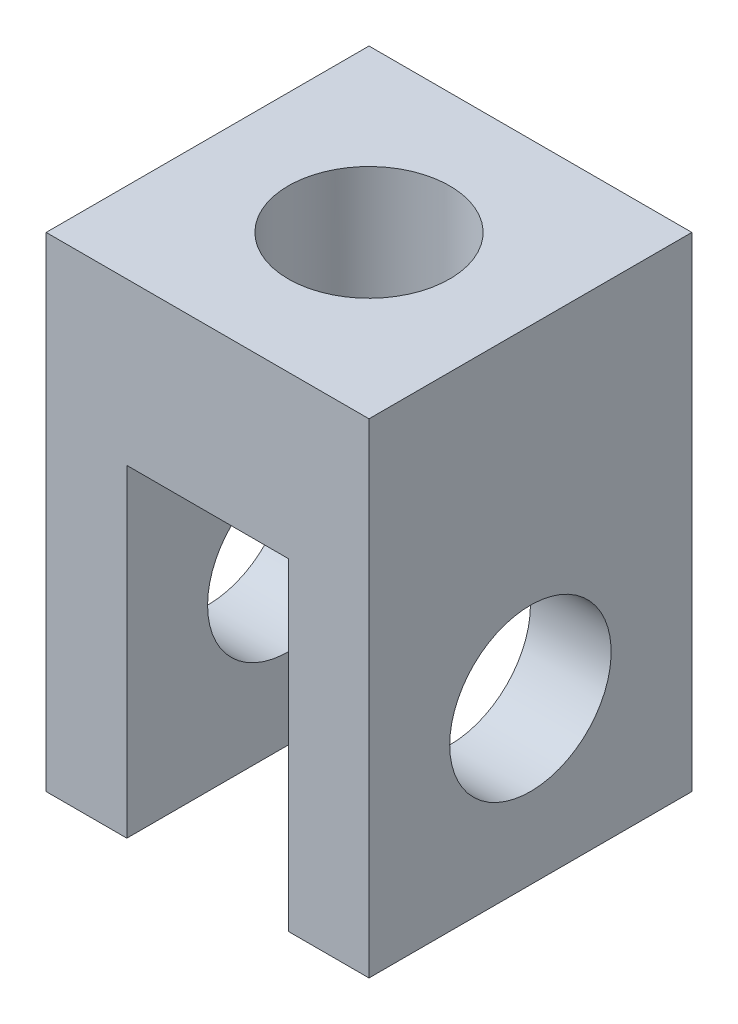
from build123d import *

# Parameters (mm, degrees)
SKETCH_1_W          = 20
SKETCH_1_H          = 20
EXTRUDE_1_DEPTH     = 10
SKETCH_2_R          = 5
CUT_EXTRUDE_2_DEPTH = 18.320508076
SKETCH_3_W          = 5
SKETCH_3_H          = 20
EXTRUDE_2_DEPTH     = 20
SKETCH_4_R          = 5
CUT_EXTRUDE_3_DEPTH = 31


with BuildPart() as part:
    # 草图1 → 凸台-拉伸1 (new body)
    with BuildSketch(Plane(origin=(0, 0, 0), x_dir=(1, 0, 0), z_dir=(0, 1, 0))):
        Rectangle(SKETCH_1_W, SKETCH_1_H)
    extrude(amount=EXTRUDE_1_DEPTH)

    # 草图2 → 切除-拉伸2 (cut, through all)
    with BuildSketch(Plane(origin=(0, 10, 0), x_dir=(1, 0, 0), z_dir=(0, 1, 0))):
        Circle(SKETCH_2_R)
    extrude(amount=-CUT_EXTRUDE_2_DEPTH, mode=Mode.SUBTRACT)

    # 草图3 → 凸台-拉伸2 (add)
    with BuildSketch(Plane.XZ):
        with Locations((-7.5, 0)):
            Rectangle(SKETCH_3_W, SKETCH_3_H)
        with Locations((7.5, 0)):
            Rectangle(SKETCH_3_W, SKETCH_3_H)
    extrude(amount=EXTRUDE_2_DEPTH)

    # 草图4 → 切除-拉伸3 (cut, through all)
    with BuildSketch(Plane.ZY.offset(10)):
        with Locations((0, -10)):
            Circle(SKETCH_4_R)
    extrude(amount=-CUT_EXTRUDE_3_DEPTH, mode=Mode.SUBTRACT)


solid = part.part
